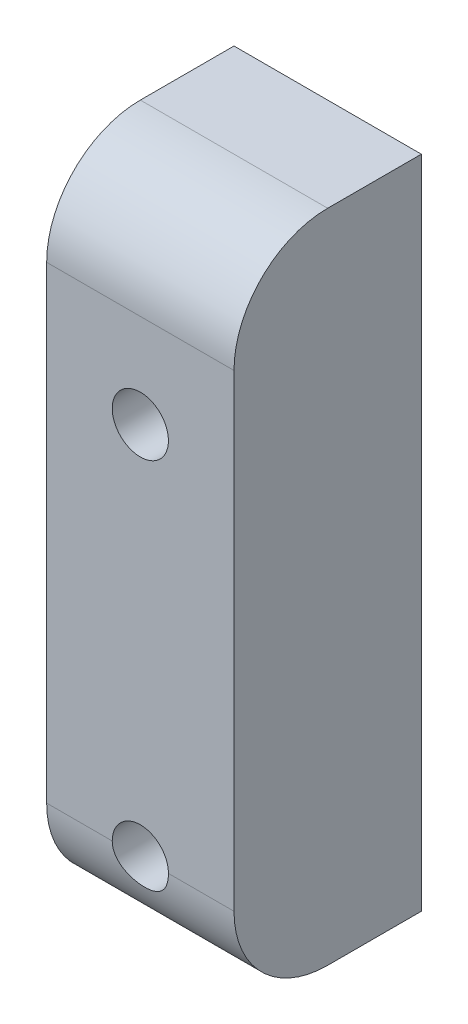
from build123d import *

# Parameters (mm, degrees)
SKETCH1_W           = 10
SKETCH1_H           = 35
SKETCH1_R           = 1.5
BOSS_EXTRUDE1_DEPTH = 10
FILLET1_R           = 5
FILLET2_R           = 5


with BuildPart() as part:
    # Sketch1 → Boss-Extrude1 (new body)
    with BuildSketch(Plane.XY):
        with Locations((5, 17.5)):
            Rectangle(SKETCH1_W, SKETCH1_H)
        with Locations((5, 25)):
            Circle(SKETCH1_R, mode=Mode.SUBTRACT)
        with Locations((5, 5)):
            Circle(SKETCH1_R, mode=Mode.SUBTRACT)
    extrude(amount=BOSS_EXTRUDE1_DEPTH)

    # Fillet1
    # the kernel refuses this fillet: 5 mm, written as the material it takes off along each edge
    with BuildSketch(Plane(origin=(-12.5, 0, 10), x_dir=(0, 0, -1), z_dir=(1, 0, 0))) as fillet1_piece_1:
        with BuildLine():
            CenterArc((FILLET1_R, FILLET1_R), FILLET1_R, 180, 90)
            Line((0, FILLET1_R), (0, 0))
            Line((0, 0), (FILLET1_R, 0))
        make_face()
    extrude(amount=35, mode=Mode.SUBTRACT)

    # Fillet2
    fillet2_edges = [part.edges().sort_by_distance(p)[0] for p in [
        (5, 35, 10),
    ]]
    fillet(fillet2_edges, radius=FILLET2_R)


solid = part.part
